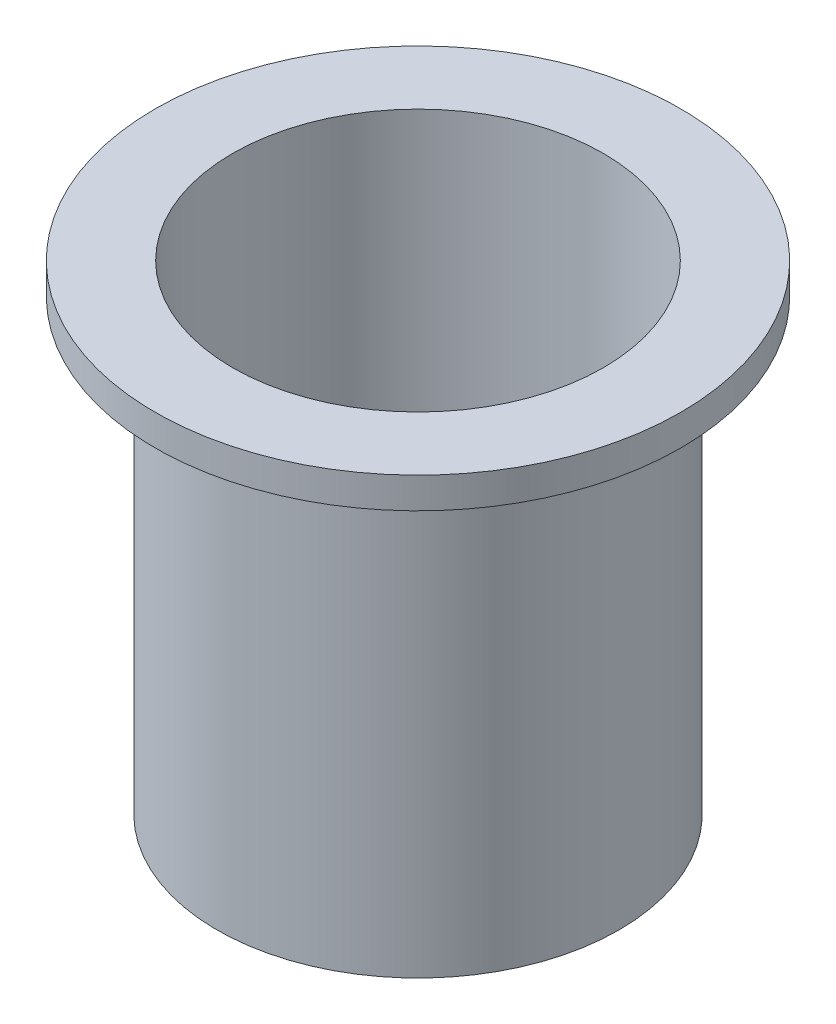
from build123d import *


with BuildPart() as part:
    # Sketch1 → Revolve1 (revolve)
    with BuildSketch(Plane.XY):
        Polygon((41.275, 0), (30.744042103, 0), (0, 0), (0, 3.175), (38.1, 3.175), (38.1, 98.425), (41.275, 98.425), (53.975, 98.425), (53.975, 92.075), (41.275, 92.075), align=None)
    revolve(axis=Axis((0, -554.392583441, 0), (0, 1, 0)))


solid = part.part
